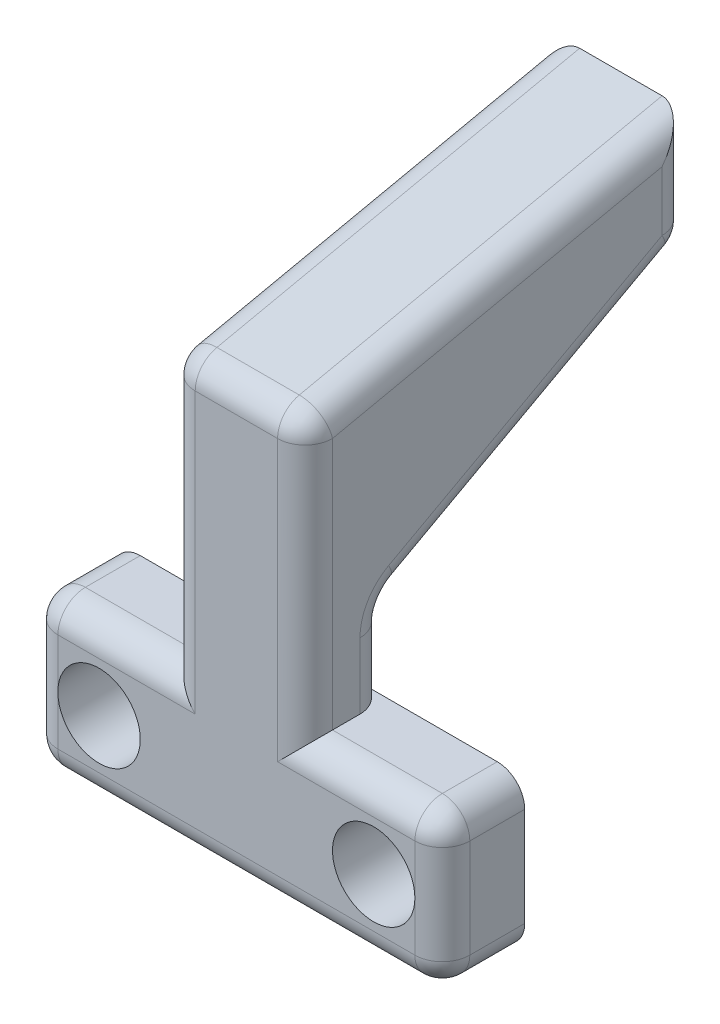
from build123d import *

# Parameters (mm, degrees)
SKETCH2_W           = 5
SKETCH2_H           = 5.6
SKETCH2_R           = 1.5
BOSS_EXTRUDE1_DEPTH = 3
SKETCH5_W           = 5
SKETCH5_H           = 8
BOSS_EXTRUDE4_DEPTH = 3
BOSS_EXTRUDE5_DEPTH = 5
FILLET3_R           = 1


with BuildPart() as part:
    # Sketch2 → Boss-Extrude1 (new body)
    # profile 1 of 3: a face of its own
    with BuildSketch(Plane.XY):
        with Locations((-5, 0)):
            Rectangle(SKETCH2_W, SKETCH2_H)
        with Locations((-5, 0)):
            Circle(SKETCH2_R, mode=Mode.SUBTRACT)
    # profile 2 of 3: a face of its own
    with BuildSketch(Plane.XY):
        Rectangle(SKETCH2_W, SKETCH2_H)
    # profile 3 of 3: a face of its own
    with BuildSketch(Plane.XY):
        with Locations((5, 0)):
            Rectangle(SKETCH2_W, SKETCH2_H)
        with Locations((5, 0)):
            Circle(SKETCH2_R, mode=Mode.SUBTRACT)
    extrude(amount=BOSS_EXTRUDE1_DEPTH)

    # Sketch5 → Boss-Extrude4 (add)
    with BuildSketch(Plane.XY.offset(3)):
        with Locations((0, 6.8)):
            Rectangle(SKETCH5_W, SKETCH5_H)
    extrude(amount=-BOSS_EXTRUDE4_DEPTH)

    # Sketch6 → Boss-Extrude5 (add)
    with BuildSketch(Plane(origin=(2.5, 0, 0), x_dir=(0, 0, -1), z_dir=(1, 0, 0))):
        Polygon((0, 5.8), (11, 11.8), (11, 15.8), (-3, 12.8), (-3, 10.8), (0, 10.8), align=None)
    extrude(amount=-BOSS_EXTRUDE5_DEPTH)

    # Fillet3
    fillet3_edges = [part.edges().sort_by_distance(p)[0] for p in [
        (0, -2.8, 3),
        (-7.5, -2.8, 1.5),
        (-7.5, 2.8, 1.5),
        (7.5, 2.8, 1.5),
        (7.5, -2.8, 1.5),
        (7.5, 0, 3),
        (-5, 2.8, 3),
        (5, 2.8, 3),
        (-2.5, 7.8, 3),
        (2.5, 7.8, 3),
        (-2.5, 4.3, 0),
        (-7.5, 0, 3),
        (2.5, 4.3, 0),
        (2.5, 8.8, -5.5),
        (2.5, 13.8, -11),
        (2.5, 14.3, -4),
        (-2.5, 8.8, -5.5),
        (0, 11.8, -11),
        (-2.5, 13.8, -11),
        (-2.5, 14.3, -4),
        (0, 12.8, 3),
        (0, 5.8, 0),
    ]]
    fillet(fillet3_edges, radius=FILLET3_R - 0.0001)  # a hair under: the kernel refuses the full size


solid = part.part
